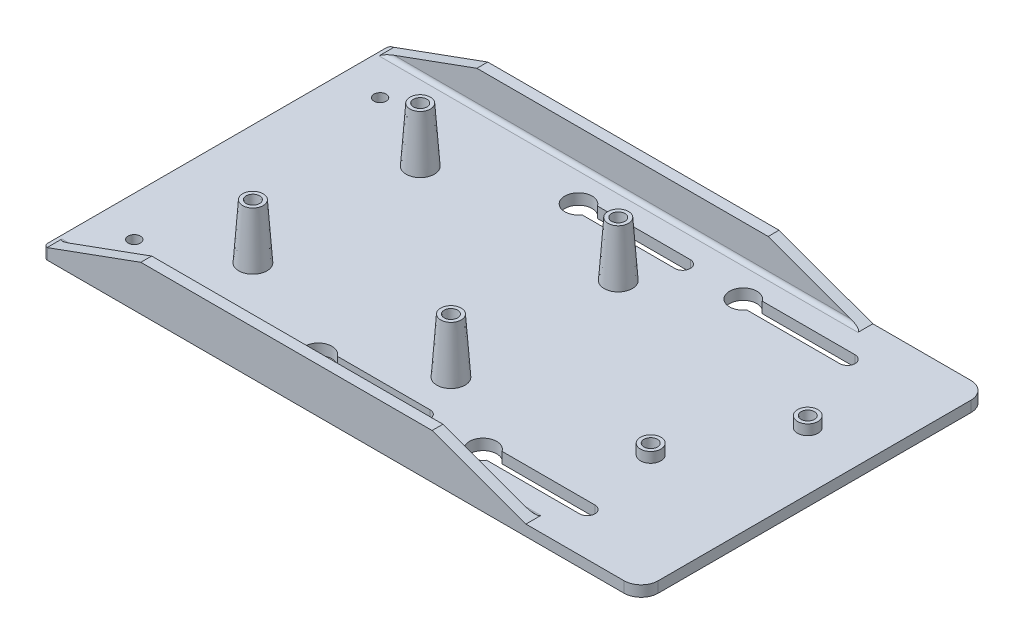
from build123d import *

# Parameters (mm, degrees)
SKETCH1_W                       = 175
SKETCH1_H                       = 101.6
PLATE_DEPTH                     = 3.175
BOTTOM_LABEL_DEPTH              = 0.6
MOUNT_SLOTS_DEPTH               = 3.175
SKETCH12_R                      = 4
SLOT_CLEARANCE_DEPTH            = 183.251805672
BRACKET_HOLES_D                 = 3.6
PLATE_STIFFENER_DEPTH           = 3.175
SKETCH15_R                      = 4.125
PI_STANDOFFS_DEPTH              = 16
PI_STANDOFFS_DRAFT              = 4
PI_STANDOFFS_PROFILE_2_DEPTH    = 16
PI_STANDOFFS_PROFILE_2_DRAFT    = 4
PI_STANDOFFS_PROFILE_3_DEPTH    = 16
PI_STANDOFFS_PROFILE_3_DRAFT    = 4
PI_STANDOFFS_PROFILE_4_DEPTH    = 16
PI_STANDOFFS_PROFILE_4_DRAFT    = 4
PI_HOLE_M2_5_TAPPED_AT_2_COUNT  = 2
PI_HOLE_M2_5_TAPPED_AT_2_PITCH  = 49
PI_HOLE_M2_5_TAPPED_AT_3_COUNT  = 2
PI_HOLE_M2_5_TAPPED_AT_3_PITCH  = 75.927597091
PI_HOLE_M2_5_TAPPED_AT_4_COUNT  = 2
PI_HOLE_M2_5_TAPPED_AT_4_PITCH  = 58
SKETCH20_R                      = 3
REG_STANDOFFS_DEPTH             = 3
REG_HOLE_M2_5_TAPPED_AT_2_COUNT = 2
REG_HOLE_M2_5_TAPPED_AT_2_PITCH = 34
FILLET_1_2MM_R                  = 1.2
FILLET2_R                       = 5


# Read off the part's stored shape, not the designer's step: mount slots
with BuildPart() as part:
    # Sketch1 → plate (new body)
    with BuildSketch(Plane(origin=(0, 0, 0), x_dir=(1, 0, 0), z_dir=(0, 1, 0))):
        with Locations((87.5, 0)):
            Rectangle(SKETCH1_W, SKETCH1_H)
    extrude(amount=PLATE_DEPTH)

    # Sketch14 → bottom label (cut)
    # profile 1 of 6: a face of its own
    with BuildSketch(Plane.XZ):
        with BuildLine():
            Line((77.403846154, 3.5), (78.086738782, 3.5))
            add(Edge.make_bspline(
                [(78.086738782, 3.5), (78.12016726, 3.49982425), (78.184959971, 3.499483602), (78.279179412, 3.49420047), (78.367428223, 3.486996801), (78.449731995, 3.475566708), (78.526052698, 3.461774931), (78.596620335, 3.445073115), (78.661210507, 3.425046501), (78.738323244, 3.39320022), (78.826243905, 3.345877051), (78.921442297, 3.275948486), (79.002846537, 3.190416023), (79.073032854, 3.093933368), (79.128833973, 2.987797596), (79.169203271, 2.874538407), (79.194761146, 2.755616665), (79.19738958, 2.673973487), (79.198717949, 2.63271234)],
                knots=[0, 0, 0, 0, 1.001505555, 1.941167018, 2.826882275, 3.653841531, 4.429895133, 5.150066043, 5.825578002, 6.45369114, 7.647487171, 8.808567382, 9.977351308, 11.170798116, 12.373658725, 13.556498008, 14.765093433, 16, 16, 16, 16], degree=3))
            add(Edge.make_bspline(
                [(79.198717949, 2.63271234), (79.19762473, 2.594059784), (79.195476453, 2.518103867), (79.174933694, 2.407009758), (79.142773025, 2.301258539), (79.098067776, 2.201236154), (79.03996578, 2.10920254), (78.971107461, 2.024415274), (78.888030659, 1.950464217), (78.825787419, 1.909121315), (78.794170673, 1.888120994)],
                knots=[0, 0, 0, 0, 1.044552857, 2.05264487, 3.044412934, 4.028983338, 5.005914585, 5.980388656, 6.974128949, 8, 8, 8, 8], degree=3))
            add(Edge.make_bspline(
                [(78.794170673, 1.888120994), (78.833931101, 1.872855995), (78.910002648, 1.84365027), (79.01468866, 1.792014806), (79.104883505, 1.735852696), (79.181280651, 1.674520846), (79.246618306, 1.608412035), (79.303671248, 1.536556921), (79.352352622, 1.458018163), (79.394065546, 1.373614627), (79.426614302, 1.284208159), (79.450990206, 1.190637383), (79.464957655, 1.093237828), (79.466945296, 1.026952448), (79.467948718, 0.993489583)],
                knots=[0, 0, 0, 0, 1.27268992, 2.434971085, 3.483601985, 4.442670788, 5.356604649, 6.2567628, 7.179492994, 8.113709626, 9.066344395, 10.018646069, 10.999752585, 12, 12, 12, 12], degree=3))
            add(Edge.make_bspline(
                [(79.467948718, 0.993489583), (79.466971872, 0.959322711), (79.4650499, 0.892098433), (79.450869928, 0.793343299), (79.426860821, 0.698968352), (79.393789675, 0.608363169), (79.35062736, 0.521703035), (79.298099396, 0.438889771), (79.235467832, 0.36075544), (79.165404963, 0.286431817), (79.086142818, 0.21960403), (79.000627063, 0.160088323), (78.907780743, 0.111142261), (78.809128749, 0.070026239), (78.703564433, 0.038619041), (78.591561826, 0.016646467), (78.473217524, 0.00184143), (78.392007773, 0.000624225), (78.350360577, 0)],
                knots=[0, 0, 0, 0, 0.978564426, 1.925352924, 2.850884081, 3.763762016, 4.682927383, 5.618979971, 6.567305752, 7.547517671, 8.540179244, 9.531824382, 10.526200242, 11.540722885, 12.589160233, 13.674978461, 14.80764778, 16, 16, 16, 16], degree=3))
            Line((78.350360577, 0), (77.403846154, 0))
            Line((77.403846154, 0), (77.403846154, 3.5))
        make_face()
        with BuildLine():
            Line((77.717948718, 3.141025641), (77.717948718, 2.019230769))
            Line((77.717948718, 2.019230769), (77.928986378, 2.019230769))
            add(Edge.make_bspline(
                [(77.928986378, 2.019230769), (77.959835174, 2.019630692), (78.019441333, 2.020403425), (78.105761229, 2.022616942), (78.185886248, 2.028814985), (78.259678081, 2.035011248), (78.327020525, 2.045085835), (78.387764386, 2.057077958), (78.442862983, 2.069760863), (78.506402529, 2.09133035), (78.578475477, 2.123208025), (78.655308581, 2.172679861), (78.723043051, 2.231604215), (78.780240239, 2.299595176), (78.827051709, 2.374461362), (78.859565424, 2.455008243), (78.881612708, 2.539228375), (78.88360424, 2.597046627), (78.884615385, 2.626402244)],
                knots=[0, 0, 0, 0, 1.156816544, 2.235205308, 3.236616184, 4.169592532, 5.011045266, 5.787822928, 6.49130361, 7.128639758, 8.301311294, 9.436451833, 10.541879658, 11.654887649, 12.756523258, 13.837046038, 14.901820046, 16, 16, 16, 16], degree=3))
            add(Edge.make_bspline(
                [(78.884615385, 2.626402244), (78.884089204, 2.645828015), (78.883057045, 2.683933787), (78.874603742, 2.739483141), (78.860236168, 2.791726894), (78.841781874, 2.841381004), (78.815993186, 2.886892854), (78.785629722, 2.92983605), (78.748944032, 2.968748169), (78.707186719, 3.005117667), (78.659178096, 3.037362195), (78.604946805, 3.065602958), (78.543759128, 3.088343735), (78.476646273, 3.108259887), (78.402575185, 3.122248181), (78.322400632, 3.133901569), (78.235465913, 3.139834311), (78.17532081, 3.140619673), (78.144230769, 3.141025641)],
                knots=[0, 0, 0, 0, 0.91205012, 1.789085906, 2.630437955, 3.453916878, 4.269457761, 5.079663411, 5.91843418, 6.774407191, 7.675494373, 8.627863946, 9.638891023, 10.736472738, 11.911756761, 13.175263542, 14.539845004, 16, 16, 16, 16], degree=3))
            Line((78.144230769, 3.141025641), (77.717948718, 3.141025641))
        make_face(mode=Mode.SUBTRACT)
        with BuildLine():
            Line((77.717948718, 1.66025641), (77.717948718, 0.358974359))
            Line((77.717948718, 0.358974359), (78.165264423, 0.358974359))
            add(Edge.make_bspline(
                [(78.165264423, 0.358974359), (78.197283349, 0.359358106), (78.258995608, 0.360097729), (78.348096838, 0.362512283), (78.430679941, 0.368004559), (78.506368077, 0.376650409), (78.57597853, 0.386028858), (78.638676233, 0.398640139), (78.694969426, 0.413089099), (78.760243734, 0.435423272), (78.833747242, 0.470119743), (78.912958099, 0.522433969), (78.983384317, 0.584757277), (79.043189576, 0.656888191), (79.092202565, 0.735319518), (79.12785802, 0.818464868), (79.149848876, 0.904950395), (79.152511046, 0.963917108), (79.153846154, 0.993489583)],
                knots=[0, 0, 0, 0, 1.160039823, 2.235823828, 3.228722157, 4.157150951, 4.99529583, 5.772374946, 6.472645482, 7.099169577, 8.269452708, 9.405989375, 10.527446681, 11.663510218, 12.788923519, 13.866172445, 14.929861265, 16, 16, 16, 16], degree=3))
            add(Edge.make_bspline(
                [(79.153846154, 0.993489583), (79.15357005, 1.011982924), (79.153022294, 1.048671306), (79.144761679, 1.102587125), (79.13274781, 1.154812998), (79.117216376, 1.205490739), (79.094596909, 1.253704115), (79.068190364, 1.300406674), (79.037228962, 1.345660154), (78.988984796, 1.402872407), (78.918812812, 1.46878942), (78.819106036, 1.533326923), (78.705733738, 1.58537473), (78.623506245, 1.607474206), (78.581029647, 1.618890224)],
                knots=[0, 0, 0, 0, 0.723448775, 1.435228256, 2.130040452, 2.821711965, 3.505591119, 4.210454504, 4.921174351, 5.648778258, 7.137944449, 8.670945889, 10.280296675, 12, 12, 12, 12], degree=3))
            add(Edge.make_bspline(
                [(78.581029647, 1.618890224), (78.564000552, 1.622345308), (78.527077959, 1.629836643), (78.466870379, 1.637744346), (78.39813451, 1.644789406), (78.320711633, 1.650000564), (78.234503792, 1.655387107), (78.139326873, 1.657481929), (78.035569558, 1.659981189), (77.963577186, 1.660162323), (77.926181891, 1.66025641)],
                knots=[0, 0, 0, 0, 0.634451884, 1.375622551, 2.216452059, 3.157844607, 4.20941857, 5.370758133, 6.634282058, 8, 8, 8, 8], degree=3))
            Line((77.926181891, 1.66025641), (77.717948718, 1.66025641))
        make_face(mode=Mode.SUBTRACT)
    # profile 2 of 6: a face of its own
    with BuildSketch(Plane.XZ):
        with BuildLine():
            add(Edge.make_bspline(
                [(82.119871795, 3.58974359), (82.184679901, 3.58810211), (82.311968368, 3.584878109), (82.499043265, 3.560199006), (82.677638361, 3.517503616), (82.8492085, 3.460640633), (83.011701476, 3.384786248), (83.166340369, 3.2931011), (83.312757242, 3.184624641), (83.448978624, 3.060195414), (83.573635574, 2.92481196), (83.683461461, 2.78033405), (83.775503754, 2.627635248), (83.851089541, 2.467174417), (83.910388151, 2.299314449), (83.951307195, 2.123160446), (83.977445345, 1.939853756), (83.980501122, 1.814826892), (83.982051282, 1.751402244)],
                knots=[0, 0, 0, 0, 1.065120563, 2.091984664, 3.0946048, 4.079830382, 5.057816894, 6.036188127, 7.030412546, 8.04752943, 9.064399622, 10.05169764, 11.02544977, 11.989514704, 12.962713494, 13.945757189, 14.957906945, 16, 16, 16, 16], degree=3))
            add(Edge.make_bspline(
                [(83.982051282, 1.751402244), (83.98050135, 1.688444797), (83.977446253, 1.564348377), (83.951277475, 1.382204933), (83.910236475, 1.207114236), (83.851640209, 1.039368583), (83.776414731, 0.87879102), (83.68375956, 0.725804066), (83.574618349, 0.580357567), (83.450411498, 0.444044902), (83.315010456, 0.319047431), (83.169780189, 0.210128556), (83.017986869, 0.116404431), (82.857677161, 0.041620757), (82.690977124, -0.018151163), (82.516394801, -0.058903793), (82.334748247, -0.085190837), (82.210877243, -0.088209353), (82.147916667, -0.08974359)],
                knots=[0, 0, 0, 0, 1.043624062, 2.057103931, 3.04512605, 4.022047818, 4.998200453, 5.980619268, 6.982898556, 8.009068085, 9.034988726, 10.034168286, 11.015286542, 11.987931943, 12.962482838, 13.94673481, 14.956375938, 16, 16, 16, 16], degree=3))
            add(Edge.make_bspline(
                [(82.147916667, -0.08974359), (82.084492348, -0.088194203), (81.959466132, -0.085139949), (81.775929096, -0.058958544), (81.599651353, -0.01801724), (81.431137001, 0.040492196), (81.270292072, 0.116109427), (81.116801989, 0.208313806), (80.971282842, 0.317720947), (80.834941095, 0.441887521), (80.710191897, 0.577059073), (80.601432521, 0.721893329), (80.509207408, 0.873548785), (80.433844076, 1.032446309), (80.374179616, 1.197817752), (80.333474798, 1.370766229), (80.307138846, 1.550305735), (80.304104, 1.672548634), (80.302564103, 1.734575321)],
                knots=[0, 0, 0, 0, 1.053102029, 2.075944431, 3.073151272, 4.055350789, 5.033113405, 6.020478099, 7.024410459, 8.052272461, 9.079885166, 10.07527673, 11.055994387, 12.023226415, 12.992069828, 13.970394897, 14.97016774, 16, 16, 16, 16], degree=3))
            add(Edge.make_bspline(
                [(80.302564103, 1.734575321), (80.303098738, 1.77620799), (80.304161264, 1.858948113), (80.316952957, 1.981814713), (80.335514658, 2.102705371), (80.362116571, 2.221276319), (80.396908238, 2.337237304), (80.437960265, 2.451388067), (80.48810011, 2.56257179), (80.544780758, 2.671315182), (80.608042566, 2.775923088), (80.677918316, 2.874802671), (80.751953684, 2.968783668), (80.833117078, 3.055430672), (80.918733523, 3.137264328), (81.010191901, 3.213027045), (81.106934146, 3.283401996), (81.209376525, 3.346822337), (81.3149948, 3.404181472), (81.423871578, 3.453403323), (81.53452815, 3.495649384), (81.647482798, 3.529890209), (81.76243557, 3.556922245), (81.879637354, 3.575329599), (81.99899478, 3.588153917), (82.079406099, 3.589211419), (82.119871795, 3.58974359)],
                knots=[0, 0, 0, 0, 1.037015668, 2.060948919, 3.074880161, 4.083647147, 5.086022904, 6.090072063, 7.104153813, 8.122640571, 9.144368836, 10.147691507, 11.138137339, 12.123020368, 13.103399296, 14.087645067, 15.080126199, 16.082011238, 17.087798457, 18.072939717, 19.057185487, 20.037253025, 21.01195951, 21.997135196, 22.992090687, 24, 24, 24, 24], degree=3))
        make_face()
        with BuildLine():
            add(Edge.make_bspline(
                [(82.135296474, 3.230769231), (82.102081841, 3.230364341), (82.035970108, 3.229558431), (81.937685572, 3.218942715), (81.840693638, 3.203812826), (81.744974276, 3.182231305), (81.650927986, 3.152827253), (81.557678145, 3.118986345), (81.466075091, 3.077765254), (81.376421233, 3.03119255), (81.289506158, 2.979643629), (81.207493457, 2.922671862), (81.130170813, 2.861613307), (81.057727546, 2.79632547), (80.990376374, 2.726475868), (80.926791673, 2.653123432), (80.869522091, 2.574171541), (80.817036514, 2.491761134), (80.770068674, 2.405999553), (80.728303319, 2.317789691), (80.69413931, 2.226412004), (80.666276934, 2.132857846), (80.643177123, 2.037275387), (80.628543199, 1.938939538), (80.61781084, 1.838344426), (80.617050994, 1.770362572), (80.616666667, 1.735977564)],
                knots=[0, 0, 0, 0, 1.008559885, 2.007477868, 2.99961109, 3.989939068, 4.984837346, 5.991145699, 7.001802488, 8.033829008, 9.059044045, 10.069351652, 11.065060232, 12.050310815, 13.029377138, 14.011219647, 14.996725999, 15.989392538, 16.977580475, 17.965360261, 18.951710183, 19.937753436, 20.929683414, 21.935841486, 22.955955122, 24, 24, 24, 24], degree=3))
            add(Edge.make_bspline(
                [(80.616666667, 1.735977564), (80.617941529, 1.685415343), (80.620449576, 1.585943813), (80.642407147, 1.440175669), (80.676229121, 1.300087383), (80.726086487, 1.166445474), (80.788437102, 1.038101191), (80.865463992, 0.916193086), (80.956723078, 0.800688212), (81.060386605, 0.692392943), (81.173709311, 0.593547138), (81.294042041, 0.50678373), (81.420095649, 0.43337348), (81.552198851, 0.373568408), (81.68964639, 0.32617867), (81.833323941, 0.293700039), (81.982274401, 0.272324583), (82.083805056, 0.270271827), (82.135296474, 0.269230769)],
                knots=[0, 0, 0, 0, 1.032063989, 2.030389145, 3.003944642, 3.970395727, 4.937377036, 5.913328081, 6.909231446, 7.93887556, 8.970685674, 9.976071282, 10.964166581, 11.944589148, 12.933237628, 13.927779006, 14.949070134, 16, 16, 16, 16], degree=3))
            add(Edge.make_bspline(
                [(82.135296474, 0.269230769), (82.169905976, 0.269706274), (82.238547012, 0.270649342), (82.340642535, 0.280148018), (82.440898746, 0.295379888), (82.539175026, 0.317310543), (82.635359838, 0.34475775), (82.729854641, 0.377365478), (82.821652931, 0.418046682), (82.911912769, 0.462994633), (82.998309011, 0.514234791), (83.080784543, 0.56927294), (83.157260523, 0.630241561), (83.229649594, 0.694559374), (83.297277283, 0.763523221), (83.359686267, 0.837043443), (83.4166664, 0.9155841), (83.469132046, 0.997869506), (83.515935309, 1.083865759), (83.556714408, 1.172395437), (83.591310524, 1.263240546), (83.619239029, 1.356532118), (83.64112449, 1.452092966), (83.65620441, 1.550051045), (83.666752849, 1.650210387), (83.667547926, 1.717954243), (83.667948718, 1.752103365)],
                knots=[0, 0, 0, 0, 1.047197238, 2.076906641, 3.100256066, 4.114471768, 5.12198147, 6.126382909, 7.136867548, 8.15857795, 9.17633901, 10.174870724, 11.156907918, 12.133735059, 13.104061851, 14.077631395, 15.04955518, 16.038496417, 17.029181396, 18.010275684, 18.986308667, 19.968651475, 20.955262928, 21.950658345, 22.966943676, 24, 24, 24, 24], degree=3))
            add(Edge.make_bspline(
                [(83.667948718, 1.752103365), (83.667547605, 1.78601887), (83.666751923, 1.85329652), (83.656209449, 1.952757338), (83.641108558, 2.05001055), (83.61934585, 2.144674353), (83.591295697, 2.236772878), (83.556708366, 2.326219625), (83.515923067, 2.413347821), (83.469114842, 2.497942118), (83.416499019, 2.579116855), (83.359004776, 2.656719268), (83.295639428, 2.729292009), (83.228213403, 2.798626703), (83.155042517, 2.863244593), (83.076458223, 2.923167114), (82.993414546, 2.979840388), (82.90548731, 3.03096595), (82.814743356, 3.078180182), (82.721629398, 3.118631186), (82.627200299, 3.153003305), (82.531696186, 3.18232027), (82.434313208, 3.2037283), (82.335709379, 3.21895635), (82.236021121, 3.229554736), (82.168977901, 3.230363114), (82.135296474, 3.230769231)],
                knots=[0, 0, 0, 0, 1.02996197, 2.043119294, 3.035359645, 4.018872909, 4.991431989, 5.957985074, 6.929999688, 7.912076566, 8.892894881, 9.867085534, 10.843653904, 11.817741046, 12.803660682, 13.806313499, 14.818574707, 15.856120519, 16.894564902, 17.924820532, 18.937903209, 19.946497019, 20.957711757, 21.963978472, 22.977135795, 24, 24, 24, 24], degree=3))
        make_face(mode=Mode.SUBTRACT)
    # profile 3 of 6: a face of its own
    with BuildSketch(Plane.XZ):
        Polygon((84.592307692, 3.141025641), (84.592307692, 3.5), (86.432051282, 3.5), (86.432051282, 3.141025641), (85.669230769, 3.141025641), (85.669230769, 0), (85.355128205, 0), (85.355128205, 3.141025641), align=None)
    # profile 4 of 6: a face of its own
    with BuildSketch(Plane.XZ):
        Polygon((86.862820513, 3.141025641), (86.862820513, 3.5), (88.702564103, 3.5), (88.702564103, 3.141025641), (87.93974359, 3.141025641), (87.93974359, 0), (87.625641026, 0), (87.625641026, 3.141025641), align=None)
    # profile 5 of 6: a face of its own
    with BuildSketch(Plane.XZ):
        with BuildLine():
            add(Edge.make_bspline(
                [(91.175, 3.58974359), (91.239808106, 3.58810211), (91.367096573, 3.584878109), (91.554171471, 3.560199006), (91.732766566, 3.517503616), (91.904336705, 3.460640633), (92.066829681, 3.384786248), (92.221468574, 3.2931011), (92.367885448, 3.184624641), (92.504106829, 3.060195414), (92.628763779, 2.92481196), (92.738589666, 2.78033405), (92.830631959, 2.627635248), (92.906217747, 2.467174417), (92.965516356, 2.299314449), (93.0064354, 2.123160446), (93.03257355, 1.939853756), (93.035629327, 1.814826892), (93.037179487, 1.751402244)],
                knots=[0, 0, 0, 0, 1.065120563, 2.091984664, 3.0946048, 4.079830382, 5.057816894, 6.036188127, 7.030412546, 8.04752943, 9.064399622, 10.05169764, 11.02544977, 11.989514704, 12.962713494, 13.945757189, 14.957906945, 16, 16, 16, 16], degree=3))
            add(Edge.make_bspline(
                [(93.037179487, 1.751402244), (93.035629555, 1.688444797), (93.032574458, 1.564348377), (93.006405681, 1.382204933), (92.965364681, 1.207114236), (92.906768414, 1.039368583), (92.831542936, 0.87879102), (92.738887765, 0.725804066), (92.629746554, 0.580357567), (92.505539703, 0.444044902), (92.370138661, 0.319047431), (92.224908394, 0.210128556), (92.073115074, 0.116404431), (91.912805366, 0.041620757), (91.746105329, -0.018151163), (91.571523006, -0.058903793), (91.389876452, -0.085190837), (91.266005448, -0.088209353), (91.203044872, -0.08974359)],
                knots=[0, 0, 0, 0, 1.043624062, 2.057103931, 3.04512605, 4.022047818, 4.998200453, 5.980619268, 6.982898556, 8.009068085, 9.034988726, 10.034168286, 11.015286542, 11.987931943, 12.962482838, 13.94673481, 14.956375938, 16, 16, 16, 16], degree=3))
            add(Edge.make_bspline(
                [(91.203044872, -0.08974359), (91.139620553, -0.088194203), (91.014594337, -0.085139949), (90.831057301, -0.058958544), (90.654779558, -0.01801724), (90.486265206, 0.040492196), (90.325420277, 0.116109427), (90.171930194, 0.208313806), (90.026411047, 0.317720947), (89.8900693, 0.441887521), (89.765320102, 0.577059073), (89.656560727, 0.721893329), (89.564335613, 0.873548785), (89.488972281, 1.032446309), (89.429307821, 1.197817752), (89.388603003, 1.370766229), (89.362267051, 1.550305735), (89.359232205, 1.672548634), (89.357692308, 1.734575321)],
                knots=[0, 0, 0, 0, 1.053102029, 2.075944431, 3.073151272, 4.055350789, 5.033113405, 6.020478099, 7.024410459, 8.052272461, 9.079885166, 10.07527673, 11.055994387, 12.023226415, 12.992069828, 13.970394897, 14.97016774, 16, 16, 16, 16], degree=3))
            add(Edge.make_bspline(
                [(89.357692308, 1.734575321), (89.358226943, 1.77620799), (89.35928947, 1.858948113), (89.372081162, 1.981814713), (89.390642863, 2.102705371), (89.417244776, 2.221276319), (89.452036443, 2.337237304), (89.49308847, 2.451388067), (89.543228316, 2.56257179), (89.599908964, 2.671315182), (89.663170772, 2.775923088), (89.733046521, 2.874802671), (89.807081889, 2.968783668), (89.888245283, 3.055430672), (89.973861728, 3.137264328), (90.065320106, 3.213027045), (90.162062351, 3.283401996), (90.264504731, 3.346822337), (90.370123005, 3.404181472), (90.478999783, 3.453403323), (90.589656355, 3.495649384), (90.702611003, 3.529890209), (90.817563775, 3.556922245), (90.934765559, 3.575329599), (91.054122986, 3.588153917), (91.134534305, 3.589211419), (91.175, 3.58974359)],
                knots=[0, 0, 0, 0, 1.037015668, 2.060948919, 3.074880161, 4.083647147, 5.086022904, 6.090072063, 7.104153813, 8.122640571, 9.144368836, 10.147691507, 11.138137339, 12.123020368, 13.103399296, 14.087645067, 15.080126199, 16.082011238, 17.087798457, 18.072939717, 19.057185487, 20.037253025, 21.01195951, 21.997135196, 22.992090687, 24, 24, 24, 24], degree=3))
        make_face()
        with BuildLine():
            add(Edge.make_bspline(
                [(91.190424679, 3.230769231), (91.157210046, 3.230364341), (91.091098313, 3.229558431), (90.992813777, 3.218942715), (90.895821843, 3.203812826), (90.800102481, 3.182231305), (90.706056191, 3.152827253), (90.61280635, 3.118986345), (90.521203296, 3.077765254), (90.431549438, 3.03119255), (90.344634363, 2.979643629), (90.262621662, 2.922671862), (90.185299018, 2.861613307), (90.112855751, 2.79632547), (90.045504579, 2.726475868), (89.981919878, 2.653123432), (89.924650296, 2.574171541), (89.872164719, 2.491761134), (89.825196879, 2.405999553), (89.783431524, 2.317789691), (89.749267515, 2.226412004), (89.721405139, 2.132857846), (89.698305328, 2.037275387), (89.683671404, 1.938939538), (89.672939045, 1.838344426), (89.672179199, 1.770362572), (89.671794872, 1.735977564)],
                knots=[0, 0, 0, 0, 1.008559885, 2.007477868, 2.99961109, 3.989939068, 4.984837346, 5.991145699, 7.001802488, 8.033829008, 9.059044045, 10.069351652, 11.065060232, 12.050310815, 13.029377138, 14.011219647, 14.996725999, 15.989392538, 16.977580475, 17.965360261, 18.951710183, 19.937753436, 20.929683414, 21.935841486, 22.955955122, 24, 24, 24, 24], degree=3))
            add(Edge.make_bspline(
                [(89.671794872, 1.735977564), (89.673069734, 1.685415343), (89.675577782, 1.585943813), (89.697535352, 1.440175669), (89.731357326, 1.300087383), (89.781214693, 1.166445474), (89.843565307, 1.038101191), (89.920592198, 0.916193086), (90.011851283, 0.800688212), (90.11551481, 0.692392943), (90.228837516, 0.593547138), (90.349170246, 0.50678373), (90.475223854, 0.43337348), (90.607327056, 0.373568408), (90.744774595, 0.32617867), (90.888452147, 0.293700039), (91.037402606, 0.272324583), (91.138933261, 0.270271827), (91.190424679, 0.269230769)],
                knots=[0, 0, 0, 0, 1.032063989, 2.030389145, 3.003944642, 3.970395727, 4.937377036, 5.913328081, 6.909231446, 7.93887556, 8.970685674, 9.976071282, 10.964166581, 11.944589148, 12.933237628, 13.927779006, 14.949070134, 16, 16, 16, 16], degree=3))
            add(Edge.make_bspline(
                [(91.190424679, 0.269230769), (91.225034181, 0.269706274), (91.293675217, 0.270649342), (91.39577074, 0.280148018), (91.496026952, 0.295379888), (91.594303231, 0.317310543), (91.690488043, 0.34475775), (91.784982846, 0.377365478), (91.876781136, 0.418046682), (91.967040974, 0.462994633), (92.053437216, 0.514234791), (92.135912748, 0.56927294), (92.212388728, 0.630241561), (92.284777799, 0.694559374), (92.352405488, 0.763523221), (92.414814473, 0.837043443), (92.471794605, 0.9155841), (92.524260251, 0.997869506), (92.571063514, 1.083865759), (92.611842613, 1.172395437), (92.646438729, 1.263240546), (92.674367234, 1.356532118), (92.696252695, 1.452092966), (92.711332615, 1.550051045), (92.721881054, 1.650210387), (92.722676131, 1.717954243), (92.723076923, 1.752103365)],
                knots=[0, 0, 0, 0, 1.047197238, 2.076906641, 3.100256066, 4.114471768, 5.12198147, 6.126382909, 7.136867548, 8.15857795, 9.17633901, 10.174870724, 11.156907918, 12.133735059, 13.104061851, 14.077631395, 15.04955518, 16.038496417, 17.029181396, 18.010275684, 18.986308667, 19.968651475, 20.955262928, 21.950658345, 22.966943676, 24, 24, 24, 24], degree=3))
            add(Edge.make_bspline(
                [(92.723076923, 1.752103365), (92.72267581, 1.78601887), (92.721880129, 1.85329652), (92.711337654, 1.952757338), (92.696236764, 2.05001055), (92.674474056, 2.144674353), (92.646423902, 2.236772878), (92.611836571, 2.326219625), (92.571051272, 2.413347821), (92.524243048, 2.497942118), (92.471627224, 2.579116855), (92.414132981, 2.656719268), (92.350767633, 2.729292009), (92.283341608, 2.798626703), (92.210170722, 2.863244593), (92.131586428, 2.923167114), (92.048542751, 2.979840388), (91.960615515, 3.03096595), (91.869871561, 3.078180182), (91.776757603, 3.118631186), (91.682328504, 3.153003305), (91.586824392, 3.18232027), (91.489441413, 3.2037283), (91.390837584, 3.21895635), (91.291149326, 3.229554736), (91.224106106, 3.230363114), (91.190424679, 3.230769231)],
                knots=[0, 0, 0, 0, 1.02996197, 2.043119294, 3.035359645, 4.018872909, 4.991431989, 5.957985074, 6.929999688, 7.912076566, 8.892894881, 9.867085534, 10.843653904, 11.817741046, 12.803660682, 13.806313499, 14.818574707, 15.856120519, 16.894564902, 17.924820532, 18.937903209, 19.946497019, 20.957711757, 21.963978472, 22.977135795, 24, 24, 24, 24], degree=3))
        make_face(mode=Mode.SUBTRACT)
    # profile 6 of 6: a face of its own
    with BuildSketch(Plane.XZ):
        Polygon((93.871794872, 0), (94.333834135, 3.5), (94.378705929, 3.5), (95.823717949, 0.628205128), (97.265224359, 3.5), (97.310797276, 3.5), (97.775641026, 0), (97.460136218, 0), (97.125, 2.518429487), (95.861578526, 0), (95.790765224, 0), (94.522435897, 2.524038462), (94.188000801, 0), align=None)
    extrude(amount=-BOTTOM_LABEL_DEPTH, mode=Mode.SUBTRACT)

    # mount slots outline → mount slots (cut)
    with BuildSketch(Plane(origin=(0, 0, 0), x_dir=(1, 0, 0), z_dir=(0, 1, 0))):
        with BuildLine():
            Line((67.75, -40.35), (98.25, -40.35))
            ThreePointArc((98.25, -40.35), (100.5, -38.1), (98.25, -35.85))
            Line((98.25, -35.85), (67.75, -35.85))
            ThreePointArc((67.75, -35.85), (65.5, -38.1), (67.75, -40.35))
        make_face()
        with BuildLine():
            ThreePointArc((146.51, -40.35), (148.76, -38.1), (146.51, -35.85))
            Line((146.51, -35.85), (116.01, -35.85))
            ThreePointArc((116.01, -35.85), (113.76, -38.1), (116.01, -40.35))
            Line((116.01, -40.35), (146.51, -40.35))
        make_face()
        with BuildLine():
            Line((116.01, 35.85), (146.51, 35.85))
            ThreePointArc((146.51, 35.85), (148.76, 38.1), (146.51, 40.35))
            Line((146.51, 40.35), (116.01, 40.35))
            ThreePointArc((116.01, 40.35), (113.76, 38.1), (116.01, 35.85))
        make_face()
        with BuildLine():
            ThreePointArc((98.25, 35.85), (100.5, 38.1), (98.25, 40.35))
            Line((98.25, 40.35), (67.75, 40.35))
            ThreePointArc((67.75, 40.35), (65.5, 38.1), (67.75, 35.85))
            Line((67.75, 35.85), (98.25, 35.85))
        make_face()
    extrude(amount=MOUNT_SLOTS_DEPTH, mode=Mode.SUBTRACT)

    # Sketch12 → slot_clearance (cut, through all)
    with BuildSketch(Plane(origin=(0, 3.175, 0), x_dir=(1, 0, 0), z_dir=(0, 1, 0))):
        with Locations((116.01, 38.1)):
            Circle(SKETCH12_R)
        with Locations((67.75, 38.1)):
            Circle(SKETCH12_R)
        with Locations((67.75, -38.1)):
            Circle(SKETCH12_R)
        with Locations((116.01, -38.1)):
            Circle(SKETCH12_R)
    extrude(amount=-SLOT_CLEARANCE_DEPTH, mode=Mode.SUBTRACT)

    # bracket holes (through all)
    with Locations(Plane(origin=(0, 3.175, 0), x_dir=(1, 0, 0), z_dir=(0, 1, 0))):
        with Locations((11.75, 36), (11.75, -36)):
            Hole(BRACKET_HOLES_D / 2)

    # Sketch13 → plate stiffener (add)
    with BuildSketch(Plane(origin=(0, 0, -50.8), x_dir=(-1, 0, 0), z_dir=(0, 0, -1))):
        Polygon((-141.26, 3.175), (-113.785225805, 13.175), (-28.474774195, 13.175), (-1, 3.175), align=None)
    plate_stiffener = extrude(amount=-PLATE_STIFFENER_DEPTH)

    # stiffener mirror: plate stiffener across plane
    add(plate_stiffener.mirror(Plane.XY))


with BuildPart() as pi_standoffs_tool:
    # Sketch15 → pi standoffs (with draft: the straight prism first)
    with BuildSketch(Plane(origin=(0, 3.175, 0), x_dir=(1, 0, 0), z_dir=(0, 1, 0))):
        with Locations((93, 24.5)):
            Circle(SKETCH15_R)
    extrude(amount=PI_STANDOFFS_DEPTH)
    # pi standoffs: the draft: its side faces are tilted about the plane it starts from
    pi_standoffs_sides = [pi_standoffs_tool.faces().sort_by_distance(p)[0] for p in [
        (88.875, 11.175, -24.5),
    ]]
    draft(pi_standoffs_sides, Plane(origin=(0, 3.175, 0), x_dir=(1, 0, 0), z_dir=(0, 1, 0)), PI_STANDOFFS_DRAFT)


with BuildPart() as part_1:
    add(part.part)

    # pi standoffs: add pi_standoffs_tool
    add(pi_standoffs_tool.part)


with BuildPart() as pi_standoffs_profile_2_tool:
    # Sketch15 → pi standoffs profile 2 (with draft: the straight prism first)
    with BuildSketch(Plane(origin=(0, 3.175, 0), x_dir=(1, 0, 0), z_dir=(0, 1, 0))):
        with Locations((35, 24.5)):
            Circle(SKETCH15_R)
    extrude(amount=PI_STANDOFFS_PROFILE_2_DEPTH)
    # pi standoffs profile 2: the draft: its side faces are tilted about the plane it starts from
    pi_standoffs_profile_2_sides = [pi_standoffs_profile_2_tool.faces().sort_by_distance(p)[0] for p in [
        (30.875, 11.175, -24.5),
    ]]
    draft(pi_standoffs_profile_2_sides, Plane(origin=(0, 3.175, 0), x_dir=(1, 0, 0), z_dir=(0, 1, 0)), PI_STANDOFFS_PROFILE_2_DRAFT)


with BuildPart() as part_2:
    add(part_1.part)

    # pi standoffs profile 2: add pi_standoffs_profile_2_tool
    add(pi_standoffs_profile_2_tool.part)


with BuildPart() as pi_standoffs_profile_3_tool:
    # Sketch15 → pi standoffs profile 3 (with draft: the straight prism first)
    with BuildSketch(Plane(origin=(0, 3.175, 0), x_dir=(1, 0, 0), z_dir=(0, 1, 0))):
        with Locations((35, -24.5)):
            Circle(SKETCH15_R)
    extrude(amount=PI_STANDOFFS_PROFILE_3_DEPTH)
    # pi standoffs profile 3: the draft: its side faces are tilted about the plane it starts from
    pi_standoffs_profile_3_sides = [pi_standoffs_profile_3_tool.faces().sort_by_distance(p)[0] for p in [
        (30.875, 11.175, 24.5),
    ]]
    draft(pi_standoffs_profile_3_sides, Plane(origin=(0, 3.175, 0), x_dir=(1, 0, 0), z_dir=(0, 1, 0)), PI_STANDOFFS_PROFILE_3_DRAFT)


with BuildPart() as part_3:
    add(part_2.part)

    # pi standoffs profile 3: add pi_standoffs_profile_3_tool
    add(pi_standoffs_profile_3_tool.part)


with BuildPart() as pi_standoffs_profile_4_tool:
    # Sketch15 → pi standoffs profile 4 (with draft: the straight prism first)
    with BuildSketch(Plane(origin=(0, 3.175, 0), x_dir=(1, 0, 0), z_dir=(0, 1, 0))):
        with Locations((93, -24.5)):
            Circle(SKETCH15_R)
    extrude(amount=PI_STANDOFFS_PROFILE_4_DEPTH)
    # pi standoffs profile 4: the draft: its side faces are tilted about the plane it starts from
    pi_standoffs_profile_4_sides = [pi_standoffs_profile_4_tool.faces().sort_by_distance(p)[0] for p in [
        (88.875, 11.175, 24.5),
    ]]
    draft(pi_standoffs_profile_4_sides, Plane(origin=(0, 3.175, 0), x_dir=(1, 0, 0), z_dir=(0, 1, 0)), PI_STANDOFFS_PROFILE_4_DRAFT)


with BuildPart() as part_4:
    add(part_3.part)

    # pi standoffs profile 4: add pi_standoffs_profile_4_tool
    add(pi_standoffs_profile_4_tool.part)

    # Sketch19 → pi hole M2.5 tapped (revolve, cut)
    with BuildSketch(Plane(origin=(35, 19.175, 24.5), x_dir=(0, 0, 1), z_dir=(1, 0, 0))):
        Polygon((0, 0), (0, 19.175), (1.77, 19.175), (1.77, 2.860133251), (1.97, 0), align=None)
    pi_hole_m2_5_tapped = revolve(axis=Axis((35, 25.525, 24.5), (0, -1, 0)), mode=Mode.SUBTRACT)

    # pi hole M2.5 tapped at 2: pi hole M2.5 tapped ×2
    with Locations(*[(0, 0, -i * PI_HOLE_M2_5_TAPPED_AT_2_PITCH) for i in range(1, PI_HOLE_M2_5_TAPPED_AT_2_COUNT)]):
        add(pi_hole_m2_5_tapped, mode=Mode.SUBTRACT)

    # pi hole M2.5 tapped at 3: pi hole M2.5 tapped ×2
    with Locations(*[Vector(0.7638856255460444, 0, -0.6453516491682101) * (i * PI_HOLE_M2_5_TAPPED_AT_3_PITCH) for i in range(1, PI_HOLE_M2_5_TAPPED_AT_3_COUNT)]):
        add(pi_hole_m2_5_tapped, mode=Mode.SUBTRACT)

    # pi hole M2.5 tapped at 4: pi hole M2.5 tapped ×2
    with Locations(*[(i * PI_HOLE_M2_5_TAPPED_AT_4_PITCH, 0, 0) for i in range(1, PI_HOLE_M2_5_TAPPED_AT_4_COUNT)]):
        add(pi_hole_m2_5_tapped, mode=Mode.SUBTRACT)

    # Sketch20 → reg standoffs (add)
    with BuildSketch(Plane(origin=(0, 3.175, 0), x_dir=(1, 0, 0), z_dir=(0, 1, 0))):
        with Locations(Location((158, 15, 0), (0, 0, 270))):
            Circle(SKETCH20_R)
        with Locations(Location((142, -15, 0), (0, 0, 270))):
            Circle(SKETCH20_R)
    extrude(amount=REG_STANDOFFS_DEPTH)

    # Sketch22 → reg hole M2.5 tapped (revolve, cut)
    with BuildSketch(Plane(origin=(142, 6.175, 15), x_dir=(0, 0, 1), z_dir=(1, 0, 0))):
        Polygon((0, 0), (0, 6.175), (1.77, 6.175), (1.77, 2.860133251), (1.97, 0), align=None)
    reg_hole_m2_5_tapped = revolve(axis=Axis((142, 12.525, 15), (0, -1, 0)), mode=Mode.SUBTRACT)

    # reg hole M2.5 tapped at 2: reg hole M2.5 tapped ×2
    with Locations(*[Vector(0.4705882352941167, 0, -0.8823529411764711) * (i * REG_HOLE_M2_5_TAPPED_AT_2_PITCH) for i in range(1, REG_HOLE_M2_5_TAPPED_AT_2_COUNT)]):
        add(reg_hole_m2_5_tapped, mode=Mode.SUBTRACT)

    # Fillet 1.2mm
    fillet_1_2mm_edges = [part_4.edges().sort_by_distance(p)[0] for p in [
        (71.13, 3.175, 47.625),
        (71.13, 3.175, -47.625),
        (0, 1.5875, -50.8),
        (0, 1.5875, 50.8),
    ]]
    fillet(fillet_1_2mm_edges, radius=FILLET_1_2MM_R)

    # Fillet2
    fillet2_edges = [part_4.edges().sort_by_distance(p)[0] for p in [
        (175, 1.5875, 50.8),
        (175, 1.5875, -50.8),
    ]]
    fillet(fillet2_edges, radius=FILLET2_R)


solid = part_4.part
